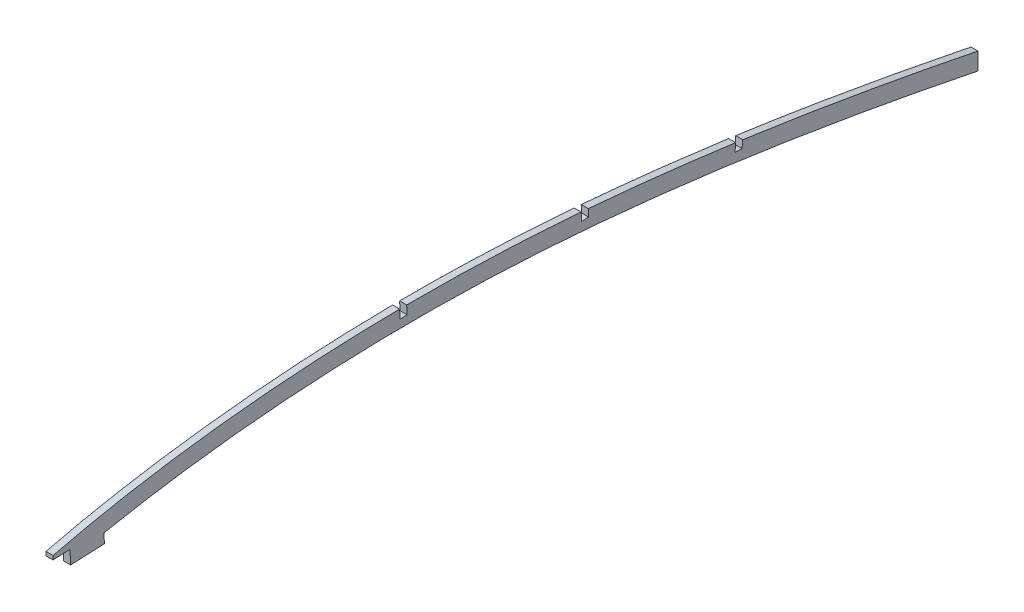
from build123d import *

# Parameters (mm, degrees)
BOSS_EXTRUDE1_DEPTH = 3.175
CUT_EXTRUDE1_DEPTH  = 527.754935473


# Read off the part's stored shape, not the designer's step: Boss-Extrude1
with BuildPart() as part:
    # Boss-Extrude1 outline → Boss-Extrude1 (new body)
    with BuildSketch(Plane(origin=(266.7, 0, 0), x_dir=(0, 0, -1), z_dir=(1, 0, 0))):
        with BuildLine():
            Line((128.027015481, 48.881499991), (127.827266707, 53.173935834))
            add(Edge.make_bspline(
                [(127.827266707, 53.173935834), (131.921402112, 53.99855442), (147.182576255, 56.889826094), (173.722026174, 60.854887486), (207.468481867, 64.267813608), (241.316867465, 66.112676281), (275.274956706, 66.541627017), (309.305825998, 65.625236621), (343.44517215, 63.361672788), (389.065328756, 58.870907886), (445.687567425, 50.945340654), (493.519820497, 42.187423282), (518.763758442, 37.095573069), (521.527266707, 36.532698197)],
                knots=[0.059536949, 0.059536949, 0.059536949, 0.059536949, 0.082006501, 0.143206068, 0.204405634, 0.265605201, 0.326804768, 0.388004334, 0.449203901, 0.510403467, 0.6328026, 0.755201734, 0.770252495, 0.770252495, 0.770252495, 0.770252495], degree=3))
            Line((521.527266707, 36.532698197), (521.527266707, 44.308584377))
            add(Edge.make_bspline(
                [(104.891436574, 55.857271259), (106.809097214, 56.330488533), (108.731061496, 56.791798305), (116.420679251, 58.588256864), (122.190022223, 59.826974293), (133.738756637, 62.117087477), (139.518165271, 63.168162708), (151.085783849, 65.106240842), (156.874011273, 65.992917854), (168.458547012, 67.615629429), (174.254837098, 68.352003798), (185.85487642, 69.685700496), (191.6586693, 70.282209193), (209.08122178, 71.863434658), (220.711342362, 72.636362119), (243.999117493, 73.668934014), (255.656564607, 73.932445396), (278.997049406, 73.982413526), (290.68010607, 73.768516469), (308.223436016, 73.098231047), (314.074354032, 72.816241787), (325.782344918, 72.137525629), (331.639378938, 71.741522982), (343.358894278, 70.847970122), (349.22421427, 70.350159344), (360.945617689, 69.2661489), (366.799040843, 68.680082864), (396.03183172, 65.54196658), (419.308162467, 62.366180875), (465.693975492, 55.004590459), (488.803352282, 50.818147164), (515.076751448, 45.610205198), (518.30260596, 44.96300802), (521.527266707, 44.308584377)],
                knots=[0.020806935, 0.020806935, 0.020806935, 0.020806935, 0.03125, 0.03125, 0.0625, 0.0625, 0.09375, 0.09375, 0.125, 0.125, 0.15625, 0.15625, 0.1875, 0.1875, 0.25, 0.25, 0.3125, 0.3125, 0.375, 0.375, 0.40625, 0.40625, 0.4375, 0.4375, 0.46875, 0.46875, 0.5, 0.5, 0.625, 0.625, 0.75, 0.75, 0.767503331, 0.767503331, 0.767503331, 0.767503331], degree=3))
            Line((104.891436574, 55.857271259), (104.891436574, 54.094460032))
            Line((104.891436574, 54.094460032), (112.511436574, 54.449057215))
            Line((112.511436574, 54.449057215), (112.803489932, 48.173072263))
            Line((112.803489932, 48.173072263), (128.027015481, 48.881499991))
        make_face()
    extrude(amount=BOSS_EXTRUDE1_DEPTH)

    # Sketch2 → Cut-Extrude1 (cut, through all)
    with BuildSketch(Plane(origin=(269.875, 0, 0), x_dir=(0, 0, -1), z_dir=(1, 0, 0))):
        Polygon((412.10223691, 59.605171111), (412.366535562, 63.163739119), (415.53281467, 62.928576184), (415.268516018, 59.370008176), align=None)
        Polygon((261.19113958, 69.865179785), (261.002434803, 73.920357299), (264.174002738, 74.067943938), (264.362707516, 70.012766424), align=None)
        Polygon((342.791359419, 70.877658902), (342.967407763, 67.094462217), (346.138975699, 67.242048857), (345.962927354, 71.025245541), align=None)
    extrude(amount=-CUT_EXTRUDE1_DEPTH, mode=Mode.SUBTRACT)


solid = part.part
